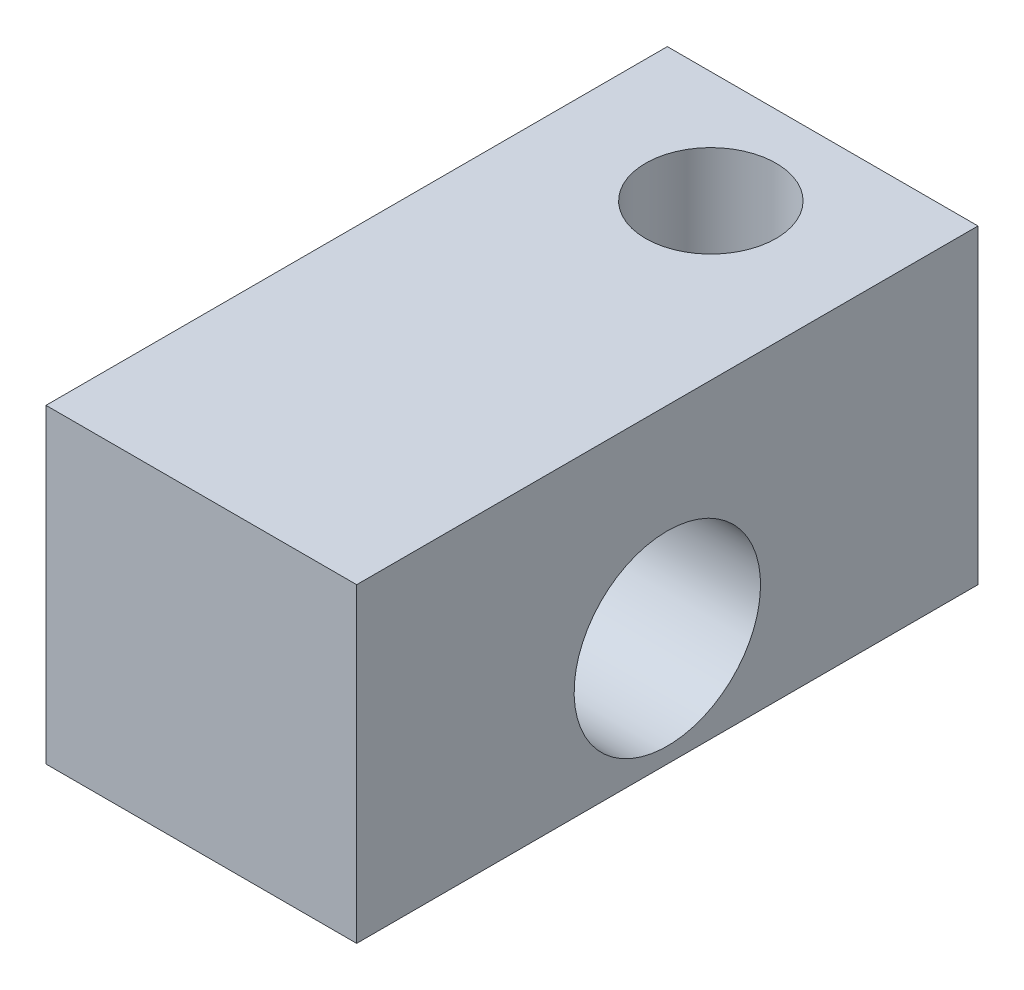
from build123d import *

# Parameters (mm, degrees)
SKETCH1_W           = 5
SKETCH1_H           = 5
BOSS_EXTRUDE1_DEPTH = 10
CUT_EXTRUDE1_REACH  = 14.247
SKETCH2_R           = 1.5
SKETCH3_R           = 1.05
CUT_EXTRUDE2_DEPTH  = 3.25
SKETCH4_R           = 1.05
CUT_EXTRUDE3_DEPTH  = 1.75


with BuildPart() as part:
    # Sketch1 → Boss-Extrude1 (new body)
    with BuildSketch(Plane.XY):
        with Locations((2.5, -2.5)):
            Rectangle(SKETCH1_W, SKETCH1_H)
    extrude(amount=BOSS_EXTRUDE1_DEPTH)

    # Sketch2 → Cut-Extrude1 (cut, up to next)
    with BuildSketch(Plane(origin=(5, 0, 0), x_dir=(0, 0, -1), z_dir=(1, 0, 0)), mode=Mode.PRIVATE) as cut_extrude1_sk1:
        with Locations((-5, -3.25)):
            Circle(SKETCH2_R)
    cut_extrude1_tool1 = extrude(cut_extrude1_sk1.sketch, amount=-CUT_EXTRUDE1_REACH, mode=Mode.PRIVATE) & part.part
    add(cut_extrude1_tool1.solids().sort_by_distance((5, -3.25, 5))[0], mode=Mode.SUBTRACT)

    # Sketch3 → Cut-Extrude2 (cut)
    with BuildSketch(Plane(origin=(0, 0, 0), x_dir=(1, 0, 0), z_dir=(0, 1, 0))):
        with Locations((2.5, -1.8)):
            Circle(SKETCH3_R)
    extrude(amount=-CUT_EXTRUDE2_DEPTH, mode=Mode.SUBTRACT)

    # Sketch4 → Cut-Extrude3 (cut)
    with BuildSketch(Plane.XZ.offset(5)):
        with Locations((2.5, 8.2)):
            Circle(SKETCH4_R)
    extrude(amount=-CUT_EXTRUDE3_DEPTH, mode=Mode.SUBTRACT)


solid = part.part
